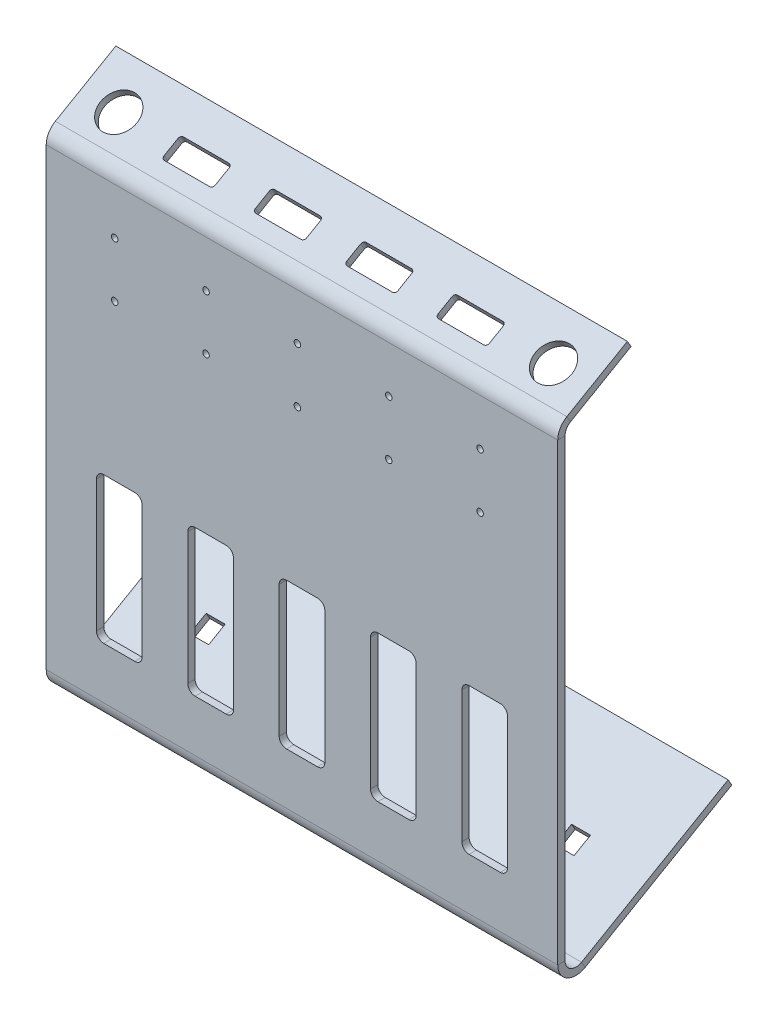
from build123d import *

# Parameters (mm, degrees)
SKETCH1_W             = 177.8
SKETCH1_H             = 157.988
BASE_FLANGE1_DEPTH    = 2.54
CUT_EXTRUDE1_DEPTH    = 238.864456664
F_4_40_TAPPED_HOLE1_D = 2.2606
LPATTERN1_COUNT       = 5
LPATTERN1_PITCH       = 31.75
EDGE_FLANGE1_DEPTH    = 177.8
EDGE_FLANGE2_DEPTH    = 177.8
CUT_EXTRUDE4_REACH    = 256.794
LPATTERN2_COUNT       = 4
LPATTERN2_PITCH       = 31.75
CUT_EXTRUDE5_REACH    = 263.778
SKETCH28_W            = 6.604
SKETCH28_H            = 6.604
CUT_EXTRUDE3_REACH    = 256.794
SKETCH24_R            = 6.35


# Sheet-metal steps are written as plain solids
with BuildPart() as part:
    # Sketch1 → Base-Flange1 (new body)
    with BuildSketch(Plane.XY):
        with Locations((88.9, 78.994)):
            Rectangle(SKETCH1_W, SKETCH1_H)
    extrude(amount=-BASE_FLANGE1_DEPTH)

    # Sketch6 → Cut-Extrude1 (cut, through all)
    with BuildSketch(Plane.XY):
        with BuildLine():
            Line((20.0025, 17.89176), (30.7975, 17.89176))
            ThreePointArc((30.7975, 17.89176), (32.593551224, 18.635708776), (33.3375, 20.43176))
            Line((33.3375, 20.43176), (33.3375, 66.15176))
            ThreePointArc((33.3375, 66.15176), (32.593551224, 67.947811224), (30.7975, 68.69176))
            Line((30.7975, 68.69176), (20.0025, 68.69176))
            ThreePointArc((20.0025, 68.69176), (18.206448776, 67.947811224), (17.4625, 66.15176))
            Line((17.4625, 66.15176), (17.4625, 20.43176))
            ThreePointArc((17.4625, 20.43176), (18.206448776, 18.635708776), (20.0025, 17.89176))
        make_face()
    cut_extrude1 = extrude(amount=-CUT_EXTRUDE1_DEPTH, mode=Mode.SUBTRACT)

    # #4-40 Tapped Hole1 (through all)
    with Locations(Plane(origin=(23.8125, 141.824456, 0), x_dir=(1, 0, 0), z_dir=(0, 0, 1))):
        with Locations((0, 0), (0, -19.05)):
            f_4_40_tapped_hole1 = Hole(F_4_40_TAPPED_HOLE1_D / 2)

    # LPattern1: Cut-Extrude1, #4-40 Tapped Hole1 ×5
    with Locations(*[(i * LPATTERN1_PITCH, 0, 0) for i in range(1, LPATTERN1_COUNT)]):
        add(cut_extrude1, mode=Mode.SUBTRACT)
        add(f_4_40_tapped_hole1, mode=Mode.SUBTRACT)

    # Edge-Flange1 section (across the edge) → Edge-Flange1 (add)
    with BuildSketch(Plane(origin=(0, 160.187704526, -2.54), x_dir=(0, -0.8660254037844364, -0.5000000000000041), z_dir=(1, 0, 0))):
        with BuildLine():
            Line((-2.54, 2.199704526), (-2.54, 26.473530316))
            Line((-2.54, 26.473530316), (0, 26.473530316))
            Line((0, 26.473530316), (0, 2.199704526))
            ThreePointArc((0, 2.199704526), (0.510443212, 0.294704526), (1.905, -1.099852263))
            Line((1.905, -1.099852263), (0.635, -3.299556788))
            ThreePointArc((0.635, -3.299556788), (-1.689261314, -0.975295474), (-2.54, 2.199704526))
        make_face()
    extrude(amount=EDGE_FLANGE1_DEPTH)

    # Edge-Flange2 section (across the edge) → Edge-Flange2 (add)
    with BuildSketch(Plane(origin=(177.8, -6.599113577, -2.54), x_dir=(0, 0.8660254037844398, 0.499999999999998), z_dir=(-1, 0, 0))):
        with BuildLine():
            Line((-2.54, 6.599113577), (-2.54, 65.450590949))
            Line((-2.54, 65.450590949), (0, 65.450590949))
            Line((0, 65.450590949), (0, 6.599113577))
            ThreePointArc((0, 6.599113577), (1.905, 3.299556788), (5.715, 3.299556788))
            Line((5.715, 3.299556788), (6.985, 1.099852263))
            ThreePointArc((6.985, 1.099852263), (0.635, 1.099852263), (-2.54, 6.599113577))
        make_face()
    extrude(amount=EDGE_FLANGE2_DEPTH)

    # Sketch25 → Cut-Extrude4 (cut, up to next)
    with BuildSketch(Plane(origin=(0, 121.240630657, 69.998310747), x_dir=(1, 0, 0), z_dir=(0, 0.8660254037844362, 0.5000000000000044)), mode=Mode.PRIVATE) as cut_extrude4_sk1:
        with BuildLine():
            Line((33.401, 97.337087105), (49.149, 97.337087105))
            ThreePointArc((49.149, 97.337087105), (49.86742049, 97.039507594), (50.165, 96.321087105))
            Line((50.165, 96.321087105), (50.165, 90.733087105))
            ThreePointArc((50.165, 90.733087105), (49.86742049, 90.014666615), (49.149, 89.717087105))
            Line((49.149, 89.717087105), (33.401, 89.717087105))
            ThreePointArc((33.401, 89.717087105), (32.68257951, 90.014666615), (32.385, 90.733087105))
            Line((32.385, 90.733087105), (32.385, 96.321087105))
            ThreePointArc((32.385, 96.321087105), (32.68257951, 97.039507594), (33.401, 97.337087105))
        make_face()
    cut_extrude4_tool1 = extrude(cut_extrude4_sk1.sketch, amount=-CUT_EXTRUDE4_REACH, mode=Mode.PRIVATE) & part.part
    cut_extrude4 = cut_extrude4_tool1.solids().sort_by_distance((41.275, 168.004174, -10.998523))[0]
    add(cut_extrude4, mode=Mode.SUBTRACT)

    # LPattern2: Cut-Extrude4 ×4
    with Locations(*[(i * LPATTERN2_PITCH, 0, 0) for i in range(1, LPATTERN2_COUNT)]):
        add(cut_extrude4, mode=Mode.SUBTRACT)

    # Sketch28 → Cut-Extrude5 (cut, up to next)
    with BuildSketch(Plane(origin=(0, -8.248891971, -4.7625), x_dir=(1, 0, 0), z_dir=(0, -0.8660254037844399, -0.49999999999999806)), mode=Mode.PRIVATE) as cut_extrude5_sk1:
        with Locations((25.4, -31.330738686)):
            Rectangle(SKETCH28_W, SKETCH28_H)
    cut_extrude5_tool1 = extrude(cut_extrude5_sk1.sketch, amount=-CUT_EXTRUDE5_REACH, mode=Mode.PRIVATE) & part.part
    # Sketch28 → Cut-Extrude5 (cut, up to next)
    with BuildSketch(Plane(origin=(0, -8.248891971, -4.7625), x_dir=(1, 0, 0), z_dir=(0, -0.8660254037844399, -0.49999999999999806)), mode=Mode.PRIVATE) as cut_extrude5_sk2:
        with Locations((152.4, -31.330738686)):
            Rectangle(SKETCH28_W, SKETCH28_H)
    cut_extrude5_tool2 = extrude(cut_extrude5_sk2.sketch, amount=-CUT_EXTRUDE5_REACH, mode=Mode.PRIVATE) & part.part
    add(cut_extrude5_tool1.solids().sort_by_distance((25.4, 7.416477, -31.895716))[0], mode=Mode.SUBTRACT)
    add(cut_extrude5_tool2.solids().sort_by_distance((152.4, 7.416477, -31.895716))[0], mode=Mode.SUBTRACT)

    # Sketch24 → Cut-Extrude3 (cut, up to next)
    with BuildSketch(Plane(origin=(0, 121.240630657, 69.998310747), x_dir=(1, 0, 0), z_dir=(0, 0.8660254037844362, 0.5000000000000044)), mode=Mode.PRIVATE) as cut_extrude3_sk1:
        with Locations(Location((13.335, 94.543087105, 0), (0, 0, 270))):
            Circle(SKETCH24_R)
    cut_extrude3_tool1 = extrude(cut_extrude3_sk1.sketch, amount=-CUT_EXTRUDE3_REACH, mode=Mode.PRIVATE) & part.part
    # Sketch24 → Cut-Extrude3 (cut, up to next)
    with BuildSketch(Plane(origin=(0, 121.240630657, 69.998310747), x_dir=(1, 0, 0), z_dir=(0, 0.8660254037844362, 0.5000000000000044)), mode=Mode.PRIVATE) as cut_extrude3_sk2:
        with Locations(Location((164.465, 94.543087105, 0), (0, 0, 270))):
            Circle(SKETCH24_R)
    cut_extrude3_tool2 = extrude(cut_extrude3_sk2.sketch, amount=-CUT_EXTRUDE3_REACH, mode=Mode.PRIVATE) & part.part
    add(cut_extrude3_tool1.solids().sort_by_distance((13.335, 168.512174, -11.878404))[0], mode=Mode.SUBTRACT)
    add(cut_extrude3_tool2.solids().sort_by_distance((164.465, 168.512174, -11.878404))[0], mode=Mode.SUBTRACT)


solid = part.part
